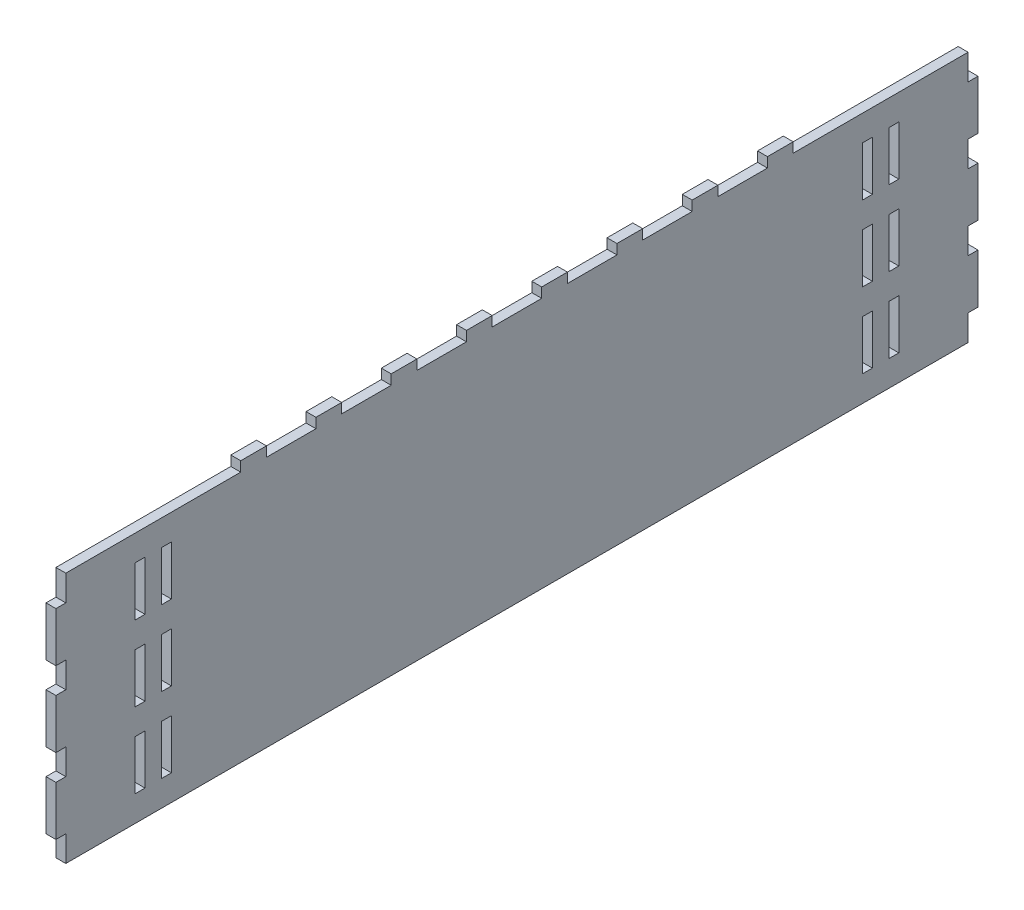
from build123d import *

# Parameters (mm, degrees)
SKETCH1_W                 = 279.4
SKETCH1_H                 = 76.2
BOSS_EXTRUDE1_DEPTH       = 3
SKETCH3_W                 = 3
SKETCH3_H                 = 15
SKETCH3_H_2               = 7.8
CUT_EXTRUDE1_DEPTH        = 145.833352512
LPATTERN1_COUNT           = 4
LPATTERN1_PITCH           = 22.8
MIRROR1_COPY_1_SKETCH_W   = 3
MIRROR1_COPY_1_SKETCH_H   = 15
MIRROR1_COPY_1_SKETCH_H_2 = 7.8
MIRROR1_COPY_1_DEPTH      = 145.833352512
MIRROR1_COPY_2_SKETCH_W   = 3
MIRROR1_COPY_2_SKETCH_H   = 15
MIRROR1_COPY_2_SKETCH_H_2 = 7.8
MIRROR1_COPY_2_DEPTH      = 145.833352512
MIRROR1_COPY_3_SKETCH_W   = 3
MIRROR1_COPY_3_SKETCH_H   = 15
MIRROR1_COPY_3_SKETCH_H_2 = 7.8
MIRROR1_COPY_3_DEPTH      = 145.833352512
MIRROR1_COPY_4_SKETCH_W   = 3
MIRROR1_COPY_4_SKETCH_H   = 15
MIRROR1_COPY_4_SKETCH_H_2 = 7.8
MIRROR1_COPY_4_DEPTH      = 145.833352512
SKETCH4_W                 = 3
SKETCH4_H                 = 15
CUT_EXTRUDE2_DEPTH        = 10
LPATTERN2_COUNT           = 3
LPATTERN2_PITCH           = 22.8
MIRROR2_COPY_1_SKETCH_W   = 3
MIRROR2_COPY_1_SKETCH_H   = 15
MIRROR2_COPY_1_DEPTH      = 10
MIRROR2_COPY_2_SKETCH_W   = 3
MIRROR2_COPY_2_SKETCH_H   = 15
MIRROR2_COPY_2_DEPTH      = 10
MIRROR2_COPY_3_SKETCH_W   = 3
MIRROR2_COPY_3_SKETCH_H   = 15
MIRROR2_COPY_3_DEPTH      = 10
SKETCH5_W                 = 3
SKETCH5_H                 = 7.8
BOSS_EXTRUDE2_DEPTH       = 3
LPATTERN3_COUNT           = 8
LPATTERN3_PITCH           = 22.8


with BuildPart() as part:
    # Sketch1 → Boss-Extrude1 (new body)
    with BuildSketch(Plane(origin=(0, 0, 0), x_dir=(0, 0, -1), z_dir=(1, 0, 0))):
        Rectangle(SKETCH1_W, SKETCH1_H)
    extrude(amount=-BOSS_EXTRUDE1_DEPTH)

    # Sketch3 → Cut-Extrude1 (cut, through all)
    with BuildSketch(Plane.ZY.offset(3)):
        with Locations((-114.2, 22.8)):
            Rectangle(SKETCH3_W, SKETCH3_H)
        with Locations((-138.2, 34.2)):
            Rectangle(SKETCH3_W, SKETCH3_H_2)
    cut_extrude1 = extrude(amount=-CUT_EXTRUDE1_DEPTH, mode=Mode.SUBTRACT)

    # LPattern1: Cut-Extrude1 ×4
    with Locations(*[(0, -i * LPATTERN1_PITCH, 0) for i in range(1, LPATTERN1_COUNT)]):
        add(cut_extrude1, mode=Mode.SUBTRACT)

    # Mirror1 copy 1 sketch → Mirror1 copy 1 (cut, through all)
    with BuildSketch(Plane(origin=(-3, -22.8, 0), x_dir=(0, 0, -1), z_dir=(-1, 0, 0))):
        with Locations((-114.2, -22.8)):
            Rectangle(MIRROR1_COPY_1_SKETCH_W, MIRROR1_COPY_1_SKETCH_H)
        with Locations((-138.2, -34.2)):
            Rectangle(MIRROR1_COPY_1_SKETCH_W, MIRROR1_COPY_1_SKETCH_H_2)
    extrude(amount=-MIRROR1_COPY_1_DEPTH, mode=Mode.SUBTRACT)

    # Mirror1 copy 2 sketch → Mirror1 copy 2 (cut, through all)
    with BuildSketch(Plane(origin=(-3, -45.6, 0), x_dir=(0, 0, -1), z_dir=(-1, 0, 0))):
        with Locations((-114.2, -22.8)):
            Rectangle(MIRROR1_COPY_2_SKETCH_W, MIRROR1_COPY_2_SKETCH_H)
        with Locations((-138.2, -34.2)):
            Rectangle(MIRROR1_COPY_2_SKETCH_W, MIRROR1_COPY_2_SKETCH_H_2)
    extrude(amount=-MIRROR1_COPY_2_DEPTH, mode=Mode.SUBTRACT)

    # Mirror1 copy 3 sketch → Mirror1 copy 3 (cut, through all)
    with BuildSketch(Plane(origin=(-3, -68.4, 0), x_dir=(0, 0, -1), z_dir=(-1, 0, 0))):
        with Locations((-114.2, -22.8)):
            Rectangle(MIRROR1_COPY_3_SKETCH_W, MIRROR1_COPY_3_SKETCH_H)
        with Locations((-138.2, -34.2)):
            Rectangle(MIRROR1_COPY_3_SKETCH_W, MIRROR1_COPY_3_SKETCH_H_2)
    extrude(amount=-MIRROR1_COPY_3_DEPTH, mode=Mode.SUBTRACT)

    # Mirror1 copy 4 sketch → Mirror1 copy 4 (cut, through all)
    with BuildSketch(Plane(origin=(-3, 0, 0), x_dir=(0, 0, -1), z_dir=(-1, 0, 0))):
        with Locations((-114.2, -22.8)):
            Rectangle(MIRROR1_COPY_4_SKETCH_W, MIRROR1_COPY_4_SKETCH_H)
        with Locations((-138.2, -34.2)):
            Rectangle(MIRROR1_COPY_4_SKETCH_W, MIRROR1_COPY_4_SKETCH_H_2)
    extrude(amount=-MIRROR1_COPY_4_DEPTH, mode=Mode.SUBTRACT)

    # Sketch4 → Cut-Extrude2 (cut)
    with BuildSketch(Plane(origin=(0, 0, 0), x_dir=(0, 0, -1), z_dir=(1, 0, 0))):
        with Locations((-106.2, 22.8)):
            Rectangle(SKETCH4_W, SKETCH4_H)
    cut_extrude2 = extrude(amount=-CUT_EXTRUDE2_DEPTH, mode=Mode.SUBTRACT)

    # LPattern2: Cut-Extrude2 ×3
    with Locations(*[(0, -i * LPATTERN2_PITCH, 0) for i in range(1, LPATTERN2_COUNT)]):
        add(cut_extrude2, mode=Mode.SUBTRACT)

    # Mirror2 copy 1 sketch → Mirror2 copy 1 (cut)
    with BuildSketch(Plane(origin=(0, -22.8, 0), x_dir=(0, 0, 1), z_dir=(1, 0, 0))):
        with Locations((-106.2, -22.8)):
            Rectangle(MIRROR2_COPY_1_SKETCH_W, MIRROR2_COPY_1_SKETCH_H)
    extrude(amount=-MIRROR2_COPY_1_DEPTH, mode=Mode.SUBTRACT)

    # Mirror2 copy 2 sketch → Mirror2 copy 2 (cut)
    with BuildSketch(Plane(origin=(0, -45.6, 0), x_dir=(0, 0, 1), z_dir=(1, 0, 0))):
        with Locations((-106.2, -22.8)):
            Rectangle(MIRROR2_COPY_2_SKETCH_W, MIRROR2_COPY_2_SKETCH_H)
    extrude(amount=-MIRROR2_COPY_2_DEPTH, mode=Mode.SUBTRACT)

    # Mirror2 copy 3 sketch → Mirror2 copy 3 (cut)
    with BuildSketch(Plane(origin=(0, 0, 0), x_dir=(0, 0, 1), z_dir=(1, 0, 0))):
        with Locations((-106.2, -22.8)):
            Rectangle(MIRROR2_COPY_3_SKETCH_W, MIRROR2_COPY_3_SKETCH_H)
    extrude(amount=-MIRROR2_COPY_3_DEPTH, mode=Mode.SUBTRACT)

    # Sketch5 → Boss-Extrude2 (add)
    with BuildSketch(Plane(origin=(0, 38.1, 0), x_dir=(1, 0, 0), z_dir=(0, 1, 0))):
        with Locations((-1.5, -79.8)):
            Rectangle(SKETCH5_W, SKETCH5_H)
    boss_extrude2 = extrude(amount=BOSS_EXTRUDE2_DEPTH)

    # LPattern3: Boss-Extrude2 ×8
    with Locations(*[(0, 0, -i * LPATTERN3_PITCH) for i in range(1, LPATTERN3_COUNT)]):
        add(boss_extrude2)


solid = part.part
